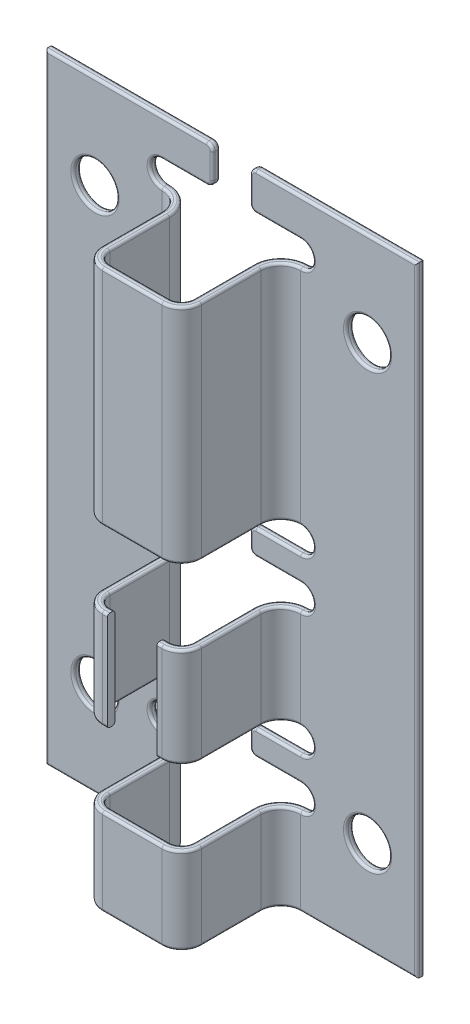
from build123d import *

# Parameters (mm, degrees)
SKETCH_1_W             = 30
SKETCH_1_H             = 50
SKETCH_1_R             = 1.75
EXTRUDE_1_DEPTH        = 0.6
EXTRUDE_2_DEPTH        = 50
SKETCH_4_W             = 8
SKETCH_4_H             = 5
SKETCH_4_H_2           = 6
CUT_EXTRUDE_1_DEPTH    = 8
FILLET_1_R             = 1
FILLET_2_R             = 1.6
FILLET_3_R             = 1.6
CUT_EXTRUDE_2_DEPTH    = 0.6
PATTERN_LINEAR_1_COUNT = 2
PATTERN_LINEAR_1_PITCH = 20
PATTERN_LINEAR_2_COUNT = 2
PATTERN_LINEAR_2_PITCH = 24
PATTERN_LINEAR_3_COUNT = 2
PATTERN_LINEAR_3_PITCH = 34
PATTERN_LINEAR_4_COUNT = 2
PATTERN_LINEAR_4_PITCH = 38
SKETCH_7_W             = 6.8
SKETCH_7_H             = 7
SKETCH_7_H_2           = 8
SKETCH_7_H_3           = 18
CUT_EXTRUDE_4_DEPTH    = 0.6
SKETCH_8_W             = 3
SKETCH_8_H             = 50
CUT_EXTRUDE_5_DEPTH    = 0.6
FILLET_4_R             = 2.2
FILLET_5_R             = 0.2
FILLET_6_R             = 0.5
CUT_EXTRUDE_6_REACH    = 32.397
SKETCH_9_W             = 4
SKETCH_9_H             = 10.09070013


with BuildPart() as part:
    # 草图1 → 凸台-拉伸1 (new body)
    with BuildSketch(Plane.XY):
        Rectangle(SKETCH_1_W, SKETCH_1_H)
        with Locations((11, 17.5)):
            Circle(SKETCH_1_R, mode=Mode.SUBTRACT)
        with Locations((-11, 17.5)):
            Circle(SKETCH_1_R, mode=Mode.SUBTRACT)
        with Locations((11, -17.5)):
            Circle(SKETCH_1_R, mode=Mode.SUBTRACT)
        with Locations((-11, -17.5)):
            Circle(SKETCH_1_R, mode=Mode.SUBTRACT)
    extrude(amount=EXTRUDE_1_DEPTH)

    # 草图3 → 凸台-拉伸2 (add)
    with BuildSketch(Plane(origin=(0, 25, 0), x_dir=(1, 0, 0), z_dir=(0, 1, 0))):
        Polygon((-4, -0.6), (-4, -8.6), (4, -8.6), (4, -0.6), (3.4, -0.6), (3.4, -8), (-3.4, -8), (-3.4, -0.6), align=None)
    extrude(amount=-EXTRUDE_2_DEPTH)

    # 草图4 → 切除-拉伸1 (cut)
    with BuildSketch(Plane.XY.offset(8.6)):
        with Locations((0, 22.5)):
            Rectangle(SKETCH_4_W, SKETCH_4_H)
        with Locations((0, -1)):
            Rectangle(SKETCH_4_W, SKETCH_4_H_2)
        with Locations((0, -15)):
            Rectangle(SKETCH_4_W, SKETCH_4_H_2)
    extrude(amount=-CUT_EXTRUDE_1_DEPTH, mode=Mode.SUBTRACT)

    # 圆角1
    fillet_1_edges = [part.edges().sort_by_distance(p)[0] for p in [
        (3.4, -8, 8),
        (-3.4, -8, 8),
        (-3.4, -21.5, 8),
        (3.4, -21.5, 8),
        (3.4, 11, 8),
        (-3.4, 11, 8),
    ]]
    fillet(fillet_1_edges, radius=FILLET_1_R)

    # 圆角2
    fillet_2_edges = [part.edges().sort_by_distance(p)[0] for p in [
        (4, -21.5, 8.6),
        (-4, -21.5, 8.6),
        (-4, 11, 8.6),
        (4, 11, 8.6),
        (-4, -8, 8.6),
        (4, -8, 8.6),
    ]]
    fillet(fillet_2_edges, radius=FILLET_2_R)

    # 圆角3
    fillet_3_edges = [part.edges().sort_by_distance(p)[0] for p in [
        (4, -8, 0.6),
        (-4, -21.5, 0.6),
        (4, -21.5, 0.6),
        (-4, 11, 0.6),
        (4, 11, 0.6),
        (-4, -8, 0.6),
    ]]
    fillet(fillet_3_edges, radius=FILLET_3_R)

    # 草图5 → 切除-拉伸2 (cut)
    with BuildSketch(Plane.XY.offset(0.6)):
        with BuildLine():
            Line((-5.6, 20), (5.6, 20))
            ThreePointArc((5.6, 20), (6.6, 21), (5.6, 22))
            Line((5.6, 22), (-5.6, 22))
            ThreePointArc((-5.6, 22), (-6.6, 21), (-5.6, 20))
        make_face()
    cut_extrude_2 = extrude(amount=-CUT_EXTRUDE_2_DEPTH, mode=Mode.SUBTRACT)

    # 阵列(线性)1: 切除-拉伸2 ×2
    with Locations(*[(0, -i * PATTERN_LINEAR_1_PITCH, 0) for i in range(1, PATTERN_LINEAR_1_COUNT)]):
        add(cut_extrude_2, mode=Mode.SUBTRACT)

    # 阵列(线性)2: 切除-拉伸2 ×2
    with Locations(*[(0, -i * PATTERN_LINEAR_2_PITCH, 0) for i in range(1, PATTERN_LINEAR_2_COUNT)]):
        add(cut_extrude_2, mode=Mode.SUBTRACT)

    # 阵列(线性)3: 切除-拉伸2 ×2
    with Locations(*[(0, -i * PATTERN_LINEAR_3_PITCH, 0) for i in range(1, PATTERN_LINEAR_3_COUNT)]):
        add(cut_extrude_2, mode=Mode.SUBTRACT)

    # 阵列(线性)4: 切除-拉伸2 ×2
    with Locations(*[(0, -i * PATTERN_LINEAR_4_PITCH, 0) for i in range(1, PATTERN_LINEAR_4_COUNT)]):
        add(cut_extrude_2, mode=Mode.SUBTRACT)

    # 草图7 → 切除-拉伸4 (cut)
    with BuildSketch(Plane.XY.offset(0.6)):
        with Locations((0, -21.5)):
            Rectangle(SKETCH_7_W, SKETCH_7_H)
        with Locations((0, -8)):
            Rectangle(SKETCH_7_W, SKETCH_7_H_2)
        with Locations((0, 11)):
            Rectangle(SKETCH_7_W, SKETCH_7_H_3)
    extrude(amount=-CUT_EXTRUDE_4_DEPTH, mode=Mode.SUBTRACT)

    # 草图8 → 切除-拉伸5 (cut)
    with BuildSketch(Plane(origin=(0, 0, 0), x_dir=(-1, 0, 0), z_dir=(0, 0, -1))):
        Rectangle(SKETCH_8_W, SKETCH_8_H)
    extrude(amount=-CUT_EXTRUDE_5_DEPTH, mode=Mode.SUBTRACT)

    # 圆角4
    fillet_4_edges = [part.edges().sort_by_distance(p)[0] for p in [
        (-3.4, -21.5, 0),
        (3.4, -21.5, 0),
        (-3.4, -8, 0),
        (3.4, -8, 0),
        (-3.4, 11, 0),
        (3.4, 11, 0),
    ]]
    fillet(fillet_4_edges, radius=FILLET_4_R)

    # 圆角5
    fillet_5_edges = [part.edges().sort_by_distance(p)[0] for p in [
        (15, 0, 0.6),
        (9.25, 17.5, 0),
        (9.25, 17.5, 0.6),
        (3.4, -25, 4.6),
        (0, -18, 8),
        (0, -25, 8),
        (-3.4, -18, 4.6),
        (8.25, 25, 0.6),
        (0, -12, 8),
        (0, -4, 8),
        (-3.4, -4, 4.6),
        (3.4, -12, 4.6),
        (3.4, 2, 4.6),
        (0, 2, 8),
        (0, 20, 8),
        (-3.4, 20, 4.6),
        (3.107106781, -18, 7.707106781),
        (3.107106781, -25, 7.707106781),
        (-3.107106781, -18, 7.707106781),
        (-3.107106781, -25, 7.707106781),
        (-3.107106781, -4, 7.707106781),
        (-3.107106781, -12, 7.707106781),
        (3.107106781, -4, 7.707106781),
        (3.107106781, -12, 7.707106781),
        (3.107106781, 20, 7.707106781),
        (3.107106781, 2, 7.707106781),
        (-3.107106781, 20, 7.707106781),
        (-3.107106781, 2, 7.707106781),
        (-12.75, 17.5, 0),
        (-12.75, 17.5, 0.6),
        (-4, -25, 4.6),
        (0, -18, 8.6),
        (3.53137085, -18, 8.13137085),
        (-3.53137085, -18, 8.13137085),
        (0, -25, 8.6),
        (3.53137085, -25, 8.13137085),
        (-3.53137085, -25, 8.13137085),
        (0, -4, 8.6),
        (3.53137085, -4, 8.13137085),
        (-3.53137085, -4, 8.13137085),
        (0, -12, 8.6),
        (3.53137085, -12, 8.13137085),
        (-3.53137085, -12, 8.13137085),
        (0, 2, 8.6),
        (0, 20, 8.6),
        (-3.53137085, 20, 8.13137085),
        (3.53137085, 20, 8.13137085),
        (-3.53137085, 2, 8.13137085),
        (3.53137085, 2, 8.13137085),
        (9.25, -17.5, 0),
        (9.25, -17.5, 0.6),
        (4, 20, 4.6),
        (4, 2, 4.6),
        (10.3, -25, 0.6),
        (4, -4, 4.6),
        (4, -12, 4.6),
        (4, -18, 4.6),
        (4, -25, 4.6),
        (-4, -18, 4.6),
        (-4, -12, 4.6),
        (-4, -4, 4.6),
        (-4, 2, 4.6),
        (-4, 20, 4.6),
        (4.46862915, 20, 1.06862915),
        (4.46862915, 2, 1.06862915),
        (4.46862915, -4, 1.06862915),
        (4.46862915, -12, 1.06862915),
        (4.46862915, -18, 1.06862915),
        (4.46862915, -25, 1.06862915),
        (-4.46862915, -18, 1.06862915),
        (-4.46862915, -25, 1.06862915),
        (-4.46862915, -4, 1.06862915),
        (-4.46862915, -12, 1.06862915),
        (-4.46862915, 20, 1.06862915),
        (-4.46862915, 2, 1.06862915),
        (-12.75, -17.5, 0),
        (-12.75, -17.5, 0.6),
        (-6.6, 21, 0.6),
        (6.6, 21, 0.6),
        (3.55, 22, 0.6),
        (-6.6, 21, 0),
        (-3.55, 22, 0),
        (6.6, 21, 0),
        (-6.6, 1, 0.6),
        (-3.55, 0, 0.6),
        (6.6, 1, 0.6),
        (-6.6, 1, 0),
        (6.6, 1, 0),
        (3.55, 0, 0),
        (-6.6, -3, 0.6),
        (6.6, -3, 0.6),
        (3.55, -2, 0.6),
        (-6.6, -3, 0),
        (-3.55, -2, 0),
        (6.6, -3, 0),
        (-6.6, -13, 0.6),
        (-3.55, -14, 0.6),
        (6.6, -13, 0.6),
        (-6.6, -13, 0),
        (6.6, -13, 0),
        (3.55, -14, 0),
        (-6.6, -17, 0.6),
        (6.6, -17, 0.6),
        (3.55, -16, 0.6),
        (-6.6, -17, 0),
        (-3.55, -16, 0),
        (6.6, -17, 0),
        (3.55, -16, 0),
        (-3.55, -16, 0.6),
        (-3.55, -14, 0),
        (3.55, -14, 0.6),
        (3.55, -2, 0),
        (-3.55, -2, 0.6),
        (-3.55, 0, 0),
        (3.55, 0, 0.6),
        (3.55, 22, 0),
        (-3.55, 22, 0.6),
        (-8.25, 25, 0),
        (-8.25, 25, 0.6),
        (1.5, 23.5, 0),
        (-1.5, 23.5, 0),
        (-1.5, -1, 0),
        (1.5, -1, 0),
        (-15, 0, 0.6),
        (-1.5, -15, 0),
        (1.5, -15, 0),
        (-1.5, 23.5, 0.6),
        (-1.5, -1, 0.6),
        (-1.5, -15, 0.6),
        (1.5, 23.5, 0.6),
        (1.5, -1, 0.6),
        (1.5, -15, 0.6),
        (-3.4, -25, 4.6),
        (3.4, -18, 4.6),
        (4.044365081, -18, 0.644365081),
        (-4.044365081, -18, 0.644365081),
        (10.3, -25, 0),
        (4.044365081, -25, 0.644365081),
        (-4.044365081, -25, 0.644365081),
        (-3.4, -12, 4.6),
        (3.4, -4, 4.6),
        (4.044365081, -4, 0.644365081),
        (-4.044365081, -4, 0.644365081),
        (4.044365081, -12, 0.644365081),
        (-4.044365081, -12, 0.644365081),
        (-3.4, 2, 4.6),
        (3.4, 20, 4.6),
        (4.044365081, 20, 0.644365081),
        (-4.044365081, 20, 0.644365081),
        (4.044365081, 2, 0.644365081),
        (-4.044365081, 2, 0.644365081),
        (8.25, 25, 0),
        (15, 0, 0),
        (-10.3, -25, 0),
        (-15, 0, 0),
        (-10.3, -25, 0.6),
    ]]
    fillet(fillet_5_edges, radius=FILLET_5_R)

    # 圆角6
    # the kernel refuses this fillet: 0.5 mm, written as the material it takes off along each edge
    with BuildSketch(Plane(origin=(-2, -15.5, 0), x_dir=(1, 0, 0), z_dir=(0, 1, 0))) as fillet_6_piece_1:
        with BuildLine():
            CenterArc((0.3, -0.2), 0.2, 0, 90)
            Line((0.5, -0.2), (0.5, 0))
            Line((0.5, 0), (0.3, 0))
        make_face()
    revolve(axis=Axis((-2, -15.5, 0), (0, 0, -1)), revolution_arc=90, mode=Mode.SUBTRACT)
    with BuildSketch(Plane(origin=(-2, -14.5, 0), x_dir=(0, 1, 0), z_dir=(-1, 0, 0))) as fillet_6_piece_2:
        with BuildLine():
            CenterArc((0.3, -0.2), 0.2, 0, 90)
            Line((0.5, -0.2), (0.5, 0))
            Line((0.5, 0), (0.3, 0))
        make_face()
    revolve(axis=Axis((-2, -14.5, 0), (0, 0, -1)), revolution_arc=90, mode=Mode.SUBTRACT)
    with BuildSketch(Plane(origin=(2, -15.5, 0), x_dir=(0, -1, 0), z_dir=(1, 0, 0))) as fillet_6_piece_3:
        with BuildLine():
            CenterArc((0.3, -0.2), 0.2, 0, 90)
            Line((0.5, -0.2), (0.5, 0))
            Line((0.5, 0), (0.3, 0))
        make_face()
    revolve(axis=Axis((2, -15.5, 0), (0, 0, -1)), revolution_arc=90, mode=Mode.SUBTRACT)
    with BuildSketch(Plane(origin=(2, -14.5, 0), x_dir=(-1, 0, 0), z_dir=(0, -1, 0))) as fillet_6_piece_4:
        with BuildLine():
            CenterArc((0.3, -0.2), 0.2, 0, 90)
            Line((0.5, -0.2), (0.5, 0))
            Line((0.5, 0), (0.3, 0))
        make_face()
    revolve(axis=Axis((2, -14.5, 0), (0, 0, -1)), revolution_arc=90, mode=Mode.SUBTRACT)
    with BuildSketch(Plane(origin=(-2, -0.5, 0), x_dir=(0, 1, 0), z_dir=(-1, 0, 0))) as fillet_6_piece_5:
        with BuildLine():
            CenterArc((0.3, -0.2), 0.2, 0, 90)
            Line((0.5, -0.2), (0.5, 0))
            Line((0.5, 0), (0.3, 0))
        make_face()
    revolve(axis=Axis((-2, -0.5, 0), (0, 0, -1)), revolution_arc=90, mode=Mode.SUBTRACT)
    with BuildSketch(Plane(origin=(-2, -1.5, 0), x_dir=(1, 0, 0), z_dir=(0, 1, 0))) as fillet_6_piece_6:
        with BuildLine():
            CenterArc((0.3, -0.2), 0.2, 0, 90)
            Line((0.5, -0.2), (0.5, 0))
            Line((0.5, 0), (0.3, 0))
        make_face()
    revolve(axis=Axis((-2, -1.5, 0), (0, 0, -1)), revolution_arc=90, mode=Mode.SUBTRACT)
    with BuildSketch(Plane(origin=(2, -0.5, 0), x_dir=(-1, 0, 0), z_dir=(0, -1, 0))) as fillet_6_piece_7:
        with BuildLine():
            CenterArc((0.3, -0.2), 0.2, 0, 90)
            Line((0.5, -0.2), (0.5, 0))
            Line((0.5, 0), (0.3, 0))
        make_face()
    revolve(axis=Axis((2, -0.5, 0), (0, 0, -1)), revolution_arc=90, mode=Mode.SUBTRACT)
    with BuildSketch(Plane(origin=(2, -1.5, 0), x_dir=(0, -1, 0), z_dir=(1, 0, 0))) as fillet_6_piece_8:
        with BuildLine():
            CenterArc((0.3, -0.2), 0.2, 0, 90)
            Line((0.5, -0.2), (0.5, 0))
            Line((0.5, 0), (0.3, 0))
        make_face()
    revolve(axis=Axis((2, -1.5, 0), (0, 0, -1)), revolution_arc=90, mode=Mode.SUBTRACT)
    with BuildSketch(Plane(origin=(-2, 24.5, 0), x_dir=(0, 1, 0), z_dir=(-1, 0, 0))) as fillet_6_piece_9:
        with BuildLine():
            CenterArc((0.3, -0.2), 0.2, 0, 90)
            Line((0.5, -0.2), (0.5, 0))
            Line((0.5, 0), (0.3, 0))
        make_face()
    revolve(axis=Axis((-2, 24.5, 0), (0, 0, -1)), revolution_arc=90, mode=Mode.SUBTRACT)
    with BuildSketch(Plane(origin=(-2, 22.5, 0), x_dir=(1, 0, 0), z_dir=(0, 1, 0))) as fillet_6_piece_10:
        with BuildLine():
            CenterArc((0.3, -0.2), 0.2, 0, 90)
            Line((0.5, -0.2), (0.5, 0))
            Line((0.5, 0), (0.3, 0))
        make_face()
    revolve(axis=Axis((-2, 22.5, 0), (0, 0, -1)), revolution_arc=90, mode=Mode.SUBTRACT)
    with BuildSketch(Plane(origin=(2, 24.5, 0), x_dir=(-1, 0, 0), z_dir=(0, -1, 0))) as fillet_6_piece_11:
        with BuildLine():
            CenterArc((0.3, -0.2), 0.2, 0, 90)
            Line((0.5, -0.2), (0.5, 0))
            Line((0.5, 0), (0.3, 0))
        make_face()
    revolve(axis=Axis((2, 24.5, 0), (0, 0, -1)), revolution_arc=90, mode=Mode.SUBTRACT)
    with BuildSketch(Plane(origin=(2, 22.5, 0), x_dir=(0, -1, 0), z_dir=(1, 0, 0))) as fillet_6_piece_12:
        with BuildLine():
            CenterArc((0.3, -0.2), 0.2, 0, 90)
            Line((0.5, -0.2), (0.5, 0))
            Line((0.5, 0), (0.3, 0))
        make_face()
    revolve(axis=Axis((2, 22.5, 0), (0, 0, -1)), revolution_arc=90, mode=Mode.SUBTRACT)
    with BuildSketch(Plane(origin=(2, -15.5, 0.6), x_dir=(-1, 0, 0), z_dir=(0, 1, 0))) as fillet_6_piece_13:
        with BuildLine():
            CenterArc((0.3, -0.2), 0.2, 0, 90)
            Line((0.5, -0.2), (0.5, 0))
            Line((0.5, 0), (0.3, 0))
        make_face()
    revolve(axis=Axis((2, -15.5, 0.6), (0, 0, 1)), revolution_arc=90, mode=Mode.SUBTRACT)
    with BuildSketch(Plane(origin=(2, -14.5, 0.6), x_dir=(0, 1, 0), z_dir=(1, 0, 0))) as fillet_6_piece_14:
        with BuildLine():
            CenterArc((0.3, -0.2), 0.2, 0, 90)
            Line((0.5, -0.2), (0.5, 0))
            Line((0.5, 0), (0.3, 0))
        make_face()
    revolve(axis=Axis((2, -14.5, 0.6), (0, 0, 1)), revolution_arc=90, mode=Mode.SUBTRACT)
    with BuildSketch(Plane(origin=(-2, -15.5, 0.6), x_dir=(0, -1, 0), z_dir=(-1, 0, 0))) as fillet_6_piece_15:
        with BuildLine():
            CenterArc((0.3, -0.2), 0.2, 0, 90)
            Line((0.5, -0.2), (0.5, 0))
            Line((0.5, 0), (0.3, 0))
        make_face()
    revolve(axis=Axis((-2, -15.5, 0.6), (0, 0, 1)), revolution_arc=90, mode=Mode.SUBTRACT)
    with BuildSketch(Plane(origin=(-2, -14.5, 0.6), x_dir=(1, 0, 0), z_dir=(0, -1, 0))) as fillet_6_piece_16:
        with BuildLine():
            CenterArc((0.3, -0.2), 0.2, 0, 90)
            Line((0.5, -0.2), (0.5, 0))
            Line((0.5, 0), (0.3, 0))
        make_face()
    revolve(axis=Axis((-2, -14.5, 0.6), (0, 0, 1)), revolution_arc=90, mode=Mode.SUBTRACT)
    with BuildSketch(Plane(origin=(2, -0.5, 0.6), x_dir=(0, 1, 0), z_dir=(1, 0, 0))) as fillet_6_piece_17:
        with BuildLine():
            CenterArc((0.3, -0.2), 0.2, 0, 90)
            Line((0.5, -0.2), (0.5, 0))
            Line((0.5, 0), (0.3, 0))
        make_face()
    revolve(axis=Axis((2, -0.5, 0.6), (0, 0, 1)), revolution_arc=90, mode=Mode.SUBTRACT)
    with BuildSketch(Plane(origin=(2, -1.5, 0.6), x_dir=(-1, 0, 0), z_dir=(0, 1, 0))) as fillet_6_piece_18:
        with BuildLine():
            CenterArc((0.3, -0.2), 0.2, 0, 90)
            Line((0.5, -0.2), (0.5, 0))
            Line((0.5, 0), (0.3, 0))
        make_face()
    revolve(axis=Axis((2, -1.5, 0.6), (0, 0, 1)), revolution_arc=90, mode=Mode.SUBTRACT)
    with BuildSketch(Plane(origin=(-2, -0.5, 0.6), x_dir=(1, 0, 0), z_dir=(0, -1, 0))) as fillet_6_piece_19:
        with BuildLine():
            CenterArc((0.3, -0.2), 0.2, 0, 90)
            Line((0.5, -0.2), (0.5, 0))
            Line((0.5, 0), (0.3, 0))
        make_face()
    revolve(axis=Axis((-2, -0.5, 0.6), (0, 0, 1)), revolution_arc=90, mode=Mode.SUBTRACT)
    with BuildSketch(Plane(origin=(-2, -1.5, 0.6), x_dir=(0, -1, 0), z_dir=(-1, 0, 0))) as fillet_6_piece_20:
        with BuildLine():
            CenterArc((0.3, -0.2), 0.2, 0, 90)
            Line((0.5, -0.2), (0.5, 0))
            Line((0.5, 0), (0.3, 0))
        make_face()
    revolve(axis=Axis((-2, -1.5, 0.6), (0, 0, 1)), revolution_arc=90, mode=Mode.SUBTRACT)
    with BuildSketch(Plane(origin=(2, 24.5, 0.6), x_dir=(0, 1, 0), z_dir=(1, 0, 0))) as fillet_6_piece_21:
        with BuildLine():
            CenterArc((0.3, -0.2), 0.2, 0, 90)
            Line((0.5, -0.2), (0.5, 0))
            Line((0.5, 0), (0.3, 0))
        make_face()
    revolve(axis=Axis((2, 24.5, 0.6), (0, 0, 1)), revolution_arc=90, mode=Mode.SUBTRACT)
    with BuildSketch(Plane(origin=(2, 22.5, 0.6), x_dir=(-1, 0, 0), z_dir=(0, 1, 0))) as fillet_6_piece_22:
        with BuildLine():
            CenterArc((0.3, -0.2), 0.2, 0, 90)
            Line((0.5, -0.2), (0.5, 0))
            Line((0.5, 0), (0.3, 0))
        make_face()
    revolve(axis=Axis((2, 22.5, 0.6), (0, 0, 1)), revolution_arc=90, mode=Mode.SUBTRACT)
    with BuildSketch(Plane(origin=(-2, 24.5, 0.6), x_dir=(1, 0, 0), z_dir=(0, -1, 0))) as fillet_6_piece_23:
        with BuildLine():
            CenterArc((0.3, -0.2), 0.2, 0, 90)
            Line((0.5, -0.2), (0.5, 0))
            Line((0.5, 0), (0.3, 0))
        make_face()
    revolve(axis=Axis((-2, 24.5, 0.6), (0, 0, 1)), revolution_arc=90, mode=Mode.SUBTRACT)
    with BuildSketch(Plane(origin=(-2, 22.5, 0.6), x_dir=(0, -1, 0), z_dir=(-1, 0, 0))) as fillet_6_piece_24:
        with BuildLine():
            CenterArc((0.3, -0.2), 0.2, 0, 90)
            Line((0.5, -0.2), (0.5, 0))
            Line((0.5, 0), (0.3, 0))
        make_face()
    revolve(axis=Axis((-2, 22.5, 0.6), (0, 0, 1)), revolution_arc=90, mode=Mode.SUBTRACT)
    with BuildSketch(Plane(origin=(1.5, 25, 0), x_dir=(1, 0, 0), z_dir=(0, 0, 1)), Plane(origin=(1.5, 22, 0), x_dir=(0, 1, 0), z_dir=(0, 0, 1)), Plane(origin=(1.5, -14, 0.6), x_dir=(0, -1, 0), z_dir=(0, 0, -1)), Plane(origin=(-1.5, -14, 0), x_dir=(0, -1, 0), z_dir=(0, 0, 1)), Plane(origin=(-1.5, 0, 0), x_dir=(0, -1, 0), z_dir=(0, 0, 1)), Plane(origin=(-1.5, 22, 0.6), x_dir=(0, 1, 0), z_dir=(0, 0, -1))) as fillet_6_piece_25:
        with BuildLine():
            CenterArc((FILLET_6_R, -FILLET_6_R), FILLET_6_R, 90, 90)
            Line((0, -FILLET_6_R), (0, 0))
            Line((0, 0), (FILLET_6_R, 0))
        make_face()
    extrude(amount=0.6, mode=Mode.SUBTRACT)
    with BuildSketch(Plane(origin=(1.5, 0, 0.6), x_dir=(1, 0, 0), z_dir=(0, 0, -1)), Plane(origin=(1.5, -2, 0), x_dir=(1, 0, 0), z_dir=(0, 0, 1)), Plane(origin=(1.5, -16, 0), x_dir=(1, 0, 0), z_dir=(0, 0, 1)), Plane(origin=(-1.5, -16, 0.6), x_dir=(-1, 0, 0), z_dir=(0, 0, -1)), Plane(origin=(-1.5, -2, 0.6), x_dir=(-1, 0, 0), z_dir=(0, 0, -1)), Plane(origin=(-1.5, 25, 0), x_dir=(-1, 0, 0), z_dir=(0, 0, 1))) as fillet_6_piece_26:
        with BuildLine():
            CenterArc((FILLET_6_R, FILLET_6_R), FILLET_6_R, 180, 90)
            Line((0, FILLET_6_R), (0, 0))
            Line((0, 0), (FILLET_6_R, 0))
        make_face()
    extrude(amount=0.6, mode=Mode.SUBTRACT)

    # 切除-拉伸6: up to this face of the body (flat: up to its plane)
    cut_extrude_6_end = Plane(part.part.faces().sort_by_distance((9.929426709, 0.367523459, 0))[0])
    # 草图9 → 切除-拉伸6 (cut, up to the picked face)
    with BuildSketch(Plane.XY.offset(8.6), mode=Mode.PRIVATE) as cut_extrude_6_sk1:
        with Locations((0, -8.023813615)):
            Rectangle(SKETCH_9_W, SKETCH_9_H)
    cut_extrude_6_tool1 = split(extrude(cut_extrude_6_sk1.sketch, amount=-CUT_EXTRUDE_6_REACH, mode=Mode.PRIVATE), bisect_by=cut_extrude_6_end, keep=Keep.BOTH, mode=Mode.PRIVATE)
    add(cut_extrude_6_tool1.solids().sort_by(Axis((0, -8.023814, 8.6), (0, 0, -1)))[0], mode=Mode.SUBTRACT)


solid = part.part
